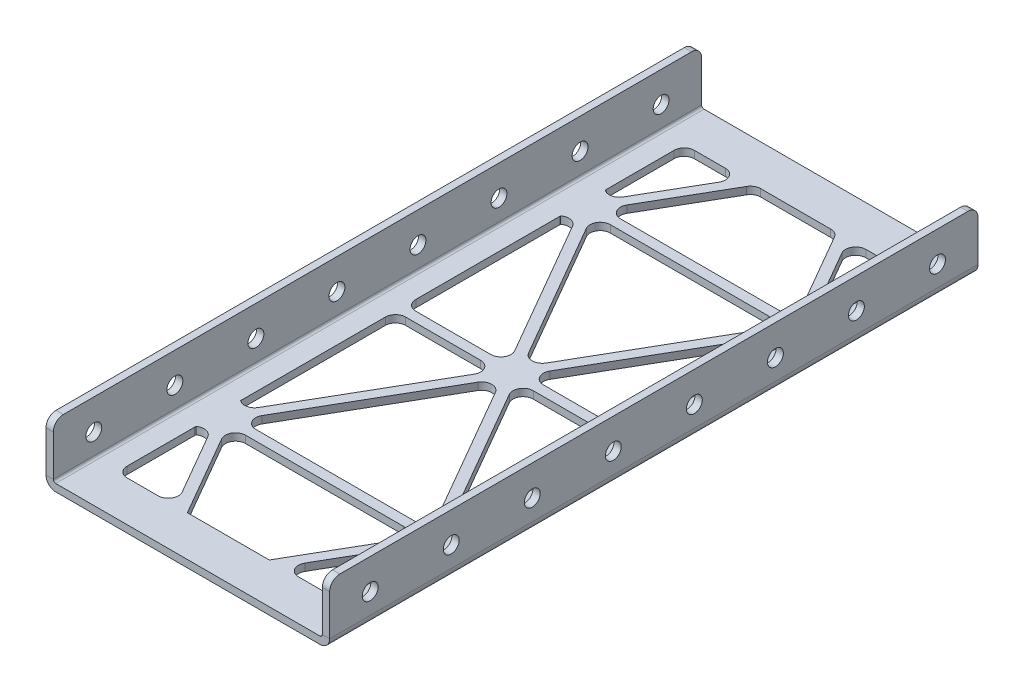
from build123d import *

# Parameters (mm, degrees)
BASE_FLANGE1_START             = -2.286
BASE_FLANGE1_OUTLINE_W         = 88.9
BASE_FLANGE1_OUTLINE_H         = 203.2
BASE_FLANGE1_DEPTH             = 2.286
EDGE_FLANGE1_STRIP_W           = 10.668
EDGE_FLANGE1_STRIP_H           = 2.286
EDGE_FLANGE1_STRIP_CUT_DEPTH   = 203.2
EDGE_FLANGE1_STRIP_2_W         = 10.668
EDGE_FLANGE1_STRIP_2_H         = 2.286
EDGE_FLANGE1_STRIP_CUT_2_DEPTH = 203.2
EDGE_FLANGE1_DEPTH             = 203.2
EDGE_FLANGE1_BEND_DEPTH        = 203.2
SKETCH22_R                     = 2.4892
CUT_EXTRUDE1_DEPTH             = 223.428599096
FILLET2_R                      = 3.175
CUT_EXTRUDE3_REACH             = 224.429
SKETCH25_W                     = 69.85
SKETCH25_H                     = 177.8
SKETCH2_W                      = 69.85
SKETCH2_H                      = 3.175
EXTRUDE_THIN1_DEPTH            = 2.286
SURFACECUT4_START              = -2.286
SURFACECUT4_DEPTH              = 2.286
FILLET4_R                      = 3.175


# Read off the part's stored shape, not the designer's step: Base-Flange1, SurfaceCut4
# Sheet-metal steps are written as plain solids
with BuildPart() as part:
    # Base-Flange1 outline → Base-Flange1 (new body)
    with BuildSketch(Plane(origin=(0, 0, 0), x_dir=(1, 0, 0), z_dir=(0, 1, 0)).offset(BASE_FLANGE1_START)):
        with Locations((44.45, 101.6)):
            Rectangle(BASE_FLANGE1_OUTLINE_W, BASE_FLANGE1_OUTLINE_H)
    extrude(amount=BASE_FLANGE1_DEPTH)

    # Edge-Flange1 strip (across the edge) → Edge-Flange1 strip cut (cut)
    with BuildSketch(Plane(origin=(88.9, 0, 0), x_dir=(-1, 0, 0), z_dir=(0, 0, -1))):
        with Locations((-2.286, -1.143)):
            Rectangle(EDGE_FLANGE1_STRIP_W, EDGE_FLANGE1_STRIP_H)
    extrude(amount=EDGE_FLANGE1_STRIP_CUT_DEPTH, mode=Mode.SUBTRACT)

    # Edge-Flange1 strip 2 (across the edge) → Edge-Flange1 strip cut 2 (cut)
    with BuildSketch(Plane.XY.offset(-203.2)):
        with Locations((-2.286, -1.143)):
            Rectangle(EDGE_FLANGE1_STRIP_2_W, EDGE_FLANGE1_STRIP_2_H)
    extrude(amount=EDGE_FLANGE1_STRIP_CUT_2_DEPTH, mode=Mode.SUBTRACT)

    # Edge-Flange1 section (across the edge) → Edge-Flange1 (add)
    with BuildSketch(Plane(origin=(88.9, 0, 0), x_dir=(-1, 0, 0), z_dir=(0, 0, -1))):
        with BuildLine():
            Line((0, 0.762), (0, 16.764))
            Line((0, 16.764), (2.286, 16.764))
            Line((2.286, 16.764), (2.286, 0.762))
            ThreePointArc((2.286, 0.762), (2.509184633, 0.223184633), (3.048, 0))
            Line((3.048, 0), (3.048, -2.286))
            ThreePointArc((3.048, -2.286), (0.892738531, -1.393261469), (0, 0.762))
        make_face()
    extrude(amount=EDGE_FLANGE1_DEPTH)

    # Edge-Flange1 section 2 (across the edge) → Edge-Flange1 bend (add)
    with BuildSketch(Plane.XY.offset(-203.2)):
        with BuildLine():
            Line((0, 0.762), (0, 16.764))
            Line((0, 16.764), (2.286, 16.764))
            Line((2.286, 16.764), (2.286, 0.762))
            ThreePointArc((2.286, 0.762), (2.509184633, 0.223184633), (3.048, 0))
            Line((3.048, 0), (3.048, -2.286))
            ThreePointArc((3.048, -2.286), (0.892738531, -1.393261469), (0, 0.762))
        make_face()
    extrude(amount=EDGE_FLANGE1_BEND_DEPTH)

    # Sketch22 → Cut-Extrude1 (cut, through all)
    with BuildSketch(Plane(origin=(88.9, 0, 0), x_dir=(0, 0, -1), z_dir=(1, 0, 0))):
        with Locations(Location((12.7, 7.239, 0), (0, 0, 90))):
            Circle(SKETCH22_R)
        with Locations(Location((38.1, 7.239, 0), (0, 0, 90))):
            Circle(SKETCH22_R)
        with Locations(Location((63.5, 7.239, 0), (0, 0, 90))):
            Circle(SKETCH22_R)
        with Locations(Location((88.9, 7.239, 0), (0, 0, 90))):
            Circle(SKETCH22_R)
        with Locations(Location((114.3, 7.239, 0), (0, 0, 90))):
            Circle(SKETCH22_R)
        with Locations(Location((139.7, 7.239, 0), (0, 0, 90))):
            Circle(SKETCH22_R)
        with Locations(Location((165.1, 7.239, 0), (0, 0, 90))):
            Circle(SKETCH22_R)
        with Locations(Location((190.5, 7.239, 0), (0, 0, 90))):
            Circle(SKETCH22_R)
        with Locations((215.9, 7.239)):
            Circle(SKETCH22_R)
        with Locations((241.3, 7.239)):
            Circle(SKETCH22_R)
        with Locations((266.7, 7.239)):
            Circle(SKETCH22_R)
        with Locations((292.1, 7.239)):
            Circle(SKETCH22_R)
        with Locations((317.5, 7.239)):
            Circle(SKETCH22_R)
        with Locations((342.9, 7.239)):
            Circle(SKETCH22_R)
        with Locations((368.3, 7.239)):
            Circle(SKETCH22_R)
        with Locations((393.7, 7.239)):
            Circle(SKETCH22_R)
    extrude(amount=-CUT_EXTRUDE1_DEPTH, mode=Mode.SUBTRACT)

    # Fillet2
    fillet2_edges = [part.edges().sort_by_distance(p)[0] for p in [
        (87.757, 16.764, 0),
        (87.757, 16.764, -203.2),
        (1.143, 16.764, -203.2),
        (1.143, 16.764, 0),
    ]]
    fillet(fillet2_edges, radius=FILLET2_R)

    # Sketch25 → Cut-Extrude3 (cut, up to next)
    with BuildSketch(Plane(origin=(0, 0, 0), x_dir=(1, 0, 0), z_dir=(0, 1, 0)), mode=Mode.PRIVATE) as cut_extrude3_sk1:
        with Locations((44.45, 101.6)):
            Rectangle(SKETCH25_W, SKETCH25_H)
    cut_extrude3_tool1 = extrude(cut_extrude3_sk1.sketch, amount=-CUT_EXTRUDE3_REACH, mode=Mode.PRIVATE) & part.part
    add(cut_extrude3_tool1.solids().sort_by_distance((44.45, 0, -101.6))[0], mode=Mode.SUBTRACT)

    # Sketch2 → Extrude-Thin1 (add)
    with BuildSketch(Plane(origin=(0, 0, 0), x_dir=(1, 0, 0), z_dir=(0, 1, 0))):
        with Locations((44.45, 101.6)):
            Rectangle(SKETCH2_W, SKETCH2_H)
        Polygon((4.149684671, 168.22719371), (82.000684671, 33.38530629), (84.750315329, 34.97280629), (6.899315329, 169.81469371), align=None)
        Polygon((6.899315329, 33.38530629), (84.750315329, 168.22719371), (82.000684671, 169.81469371), (4.149684671, 34.97280629), align=None)
        with Locations((44.45, 44.45)):
            Rectangle(SKETCH2_W, SKETCH2_H)
        with Locations((44.45, -12.7)):
            Rectangle(SKETCH2_W, SKETCH2_H)
        Polygon((4.149684671, 53.92719371), (82.000684671, -80.91469371), (84.750315329, -79.32719371), (6.899315329, 55.51469371), align=None)
        Polygon((6.899315329, -80.91469371), (84.750315329, 53.92719371), (82.000684671, 55.51469371), (4.149684671, -79.32719371), align=None)
        Polygon((4.149684671, 396.82719371), (82.000684671, 261.98530629), (84.750315329, 263.57280629), (6.899315329, 398.41469371), align=None)
        Polygon((6.899315329, 261.98530629), (84.750315329, 396.82719371), (82.000684671, 398.41469371), (4.149684671, 263.57280629), align=None)
        with Locations((44.45, 330.2)):
            Rectangle(SKETCH2_W, SKETCH2_H)
        with Locations((44.45, 273.05)):
            Rectangle(SKETCH2_W, SKETCH2_H)
        with Locations((44.45, -127)):
            Rectangle(SKETCH2_W, SKETCH2_H)
        Polygon((4.149684671, -60.37280629), (82.000684671, -195.21469371), (84.750315329, -193.62719371), (6.899315329, -58.78530629), align=None)
        Polygon((6.899315329, -195.21469371), (84.750315329, -60.37280629), (82.000684671, -58.78530629), (4.149684671, -193.62719371), align=None)
        with Locations((44.45, -184.15)):
            Rectangle(SKETCH2_W, SKETCH2_H)
        with Locations((44.45, -69.85)):
            Rectangle(SKETCH2_W, SKETCH2_H)
        Polygon((4.149684671, 282.52719371), (82.000684671, 147.68530629), (84.750315329, 149.27280629), (6.899315329, 284.11469371), align=None)
        Polygon((6.899315329, 147.68530629), (84.750315329, 282.52719371), (82.000684671, 284.11469371), (4.149684671, 149.27280629), align=None)
        with Locations((44.45, 215.9)):
            Rectangle(SKETCH2_W, SKETCH2_H)
        with Locations((44.45, 158.75)):
            Rectangle(SKETCH2_W, SKETCH2_H)
    extrude(amount=-EXTRUDE_THIN1_DEPTH)

    # SurfaceCut4 outline → SurfaceCut4 (cut)
    # profile 1 of 2: a face of its own
    with BuildSketch(Plane(origin=(0, 0, 0), x_dir=(1, 0, 0), z_dir=(0, 1, 0)).offset(SURFACECUT4_START)):
        Polygon((41.700369343, -14.2875), (11.454432116, -66.675), (6.899315329, -58.78530629), (4.149684671, -60.37280629), (9.525, -69.683125546), (9.525, -70.016874454), (4.149684671, -79.32719371), (6.899315329, -80.91469371), (11.454432116, -73.025), (41.700369343, -125.4125), (9.525, -125.4125), (9.525, -128.5875), (41.700369343, -128.5875), (10.537888563, -182.5625), (9.525, -182.5625), (9.525, -184.316874454), (4.149684671, -193.62719371), (6.899315329, -195.21469371), (12.370975668, -185.7375), (76.529024332, -185.7375), (82.000684671, -195.21469371), (84.750315329, -193.62719371), (79.375, -184.316874454), (79.375, -182.5625), (78.362111437, -182.5625), (47.199630657, -128.5875), (79.375, -128.5875), (79.375, -125.4125), (47.199630657, -125.4125), (77.445567884, -73.025), (82.000684671, -80.91469371), (84.750315329, -79.32719371), (79.375, -70.016874454), (79.375, -69.683125546), (84.750315329, -60.37280629), (82.000684671, -58.78530629), (77.445567884, -66.675), (47.199630657, -14.2875), (79.375, -14.2875), (79.375, -11.1125), (47.199630657, -11.1125), (53.615435523, 0), (49.949261314, 0), (44.45, -9.525), (38.950738686, 0), (35.284564477, 0), (41.700369343, -11.1125), (9.525, -11.1125), (9.525, -14.2875), align=None)
        Polygon((74.695937227, -182.5625), (14.204062773, -182.5625), (44.45, -130.175), align=None, mode=Mode.SUBTRACT)
        Polygon((44.45, -123.825), (14.204062773, -71.4375), (74.695937227, -71.4375), align=None, mode=Mode.SUBTRACT)
        Polygon((74.695937227, -68.2625), (14.204062773, -68.2625), (44.45, -15.875), align=None, mode=Mode.SUBTRACT)
    # profile 2 of 2: a face of its own
    with BuildSketch(Plane(origin=(0, 0, 0), x_dir=(1, 0, 0), z_dir=(0, 1, 0)).offset(SURFACECUT4_START)):
        Polygon((82.000684671, 284.11469371), (77.445567884, 276.225), (47.199630657, 328.6125), (79.375, 328.6125), (79.375, 331.7875), (47.199630657, 331.7875), (84.750315329, 396.82719371), (82.000684671, 398.41469371), (44.45, 333.375), (6.899315329, 398.41469371), (4.149684671, 396.82719371), (41.700369343, 331.7875), (9.525, 331.7875), (9.525, 328.6125), (41.700369343, 328.6125), (11.454432116, 276.225), (6.899315329, 284.11469371), (4.149684671, 282.52719371), (9.525, 273.216874454), (9.525, 272.883125546), (4.149684671, 263.57280629), (6.899315329, 261.98530629), (11.454432116, 269.875), (41.700369343, 217.4875), (9.525, 217.4875), (9.525, 214.3125), (41.700369343, 214.3125), (35.284564477, 203.2), (38.950738686, 203.2), (44.45, 212.725), (49.949261314, 203.2), (53.615435523, 203.2), (47.199630657, 214.3125), (79.375, 214.3125), (79.375, 217.4875), (47.199630657, 217.4875), (77.445567884, 269.875), (82.000684671, 261.98530629), (84.750315329, 263.57280629), (79.375, 272.883125546), (79.375, 273.216874454), (84.750315329, 282.52719371), align=None)
        Polygon((74.695937227, 271.4625), (44.45, 219.075), (14.204062773, 271.4625), align=None, mode=Mode.SUBTRACT)
        Polygon((74.695937227, 274.6375), (14.204062773, 274.6375), (44.45, 327.025), align=None, mode=Mode.SUBTRACT)
    extrude(amount=SURFACECUT4_DEPTH, mode=Mode.SUBTRACT)

    # Fillet4
    # the kernel refuses this fillet: 3.175 mm, written as the material it adds along each edge
    with BuildSketch(Plane(origin=(79.375, 0, -152.233125546), x_dir=(-0.5000000000000283, 0, -0.8660254037844223), z_dir=(0, -1, 0)), Plane(origin=(79.375, -2.286, -165.266874454), x_dir=(-0.5000000000000032, 0, 0.8660254037844368), z_dir=(0, 1, 0)), Plane(origin=(9.525, -2.286, -37.933125546), x_dir=(0.4999999999999835, 0, -0.8660254037844481), z_dir=(0, 1, 0)), Plane(origin=(9.525, -2.286, -152.233125546), x_dir=(0.4999999999999966, 0, -0.8660254037844406), z_dir=(0, 1, 0)), Plane(origin=(79.375, -2.286, -50.966874454), x_dir=(-0.4999999999999871, 0, 0.8660254037844461), z_dir=(0, 1, 0))) as fillet4_piece_1:
        with BuildLine():
            CenterArc((FILLET4_R * 0.267949192431, -FILLET4_R), FILLET4_R, 90, 30)
            Line((-FILLET4_R * 0.232050807569, -FILLET4_R * 0.133974596216), (0, 0))
            Line((0, 0), (FILLET4_R * 0.267949192431, 0))
        make_face()
    extrude(amount=2.286)
    with BuildSketch(Plane(origin=(79.375, 0, -103.1875), x_dir=(-1, 0, 0), z_dir=(0, -1, 0)), Plane(origin=(9.525, 0, -12.7), x_dir=(0, 0, -1), z_dir=(0, -1, 0)), Plane(origin=(9.525, 0, -190.5), x_dir=(1, 0, 0), z_dir=(0, -1, 0)), Plane(origin=(9.525, 0, -100.0125), x_dir=(1, 0, 0), z_dir=(0, -1, 0)), Plane(origin=(9.525, 0, -103.1875), x_dir=(0, 0, -1), z_dir=(0, -1, 0))) as fillet4_piece_2:
        with BuildLine():
            CenterArc((FILLET4_R, FILLET4_R), FILLET4_R, 180, 90)
            Line((0, FILLET4_R), (0, 0))
            Line((0, 0), (FILLET4_R, 0))
        make_face()
    extrude(amount=2.286)
    with BuildSketch(Plane(origin=(14.204062773, -2.286, -46.0375), x_dir=(1, 0, 0), z_dir=(0, 1, 0)), Plane(origin=(47.199630657, 0, -103.1875), x_dir=(0.49999999999999895, 0, -0.8660254037844393), z_dir=(0, -1, 0)), Plane(origin=(14.204062773, -2.286, -160.3375), x_dir=(1, 0, 0), z_dir=(0, 1, 0)), Plane(origin=(27.952216058, 0, -12.7), x_dir=(-1, 0, 0), z_dir=(0, -1, 0)), Plane(origin=(41.700369343, 0, -100.0125), x_dir=(-0.4999999999999996, 0, 0.8660254037844388), z_dir=(0, -1, 0)), Plane(origin=(74.695937227, 0, -160.3375), x_dir=(-1, 0, 0), z_dir=(0, -1, 0)), Plane(origin=(74.695937227, 0, -46.0375), x_dir=(-1, 0, 0), z_dir=(0, -1, 0)), Plane(origin=(41.700369343, -2.286, -103.1875), x_dir=(-0.4999999999999983, 0, -0.8660254037844397), z_dir=(0, 1, 0)), Plane(origin=(77.445567884, 0, -155.575), x_dir=(0.4999999999999918, 0, 0.8660254037844435), z_dir=(0, -1, 0)), Plane(origin=(60.947783942, 0, -190.5), x_dir=(1, 0, 0), z_dir=(0, -1, 0)), Plane(origin=(11.454432116, -2.286, -161.925), x_dir=(0.5000000000000006, 0, -0.8660254037844383), z_dir=(0, 1, 0)), Plane(origin=(77.445567884, 0, -161.925), x_dir=(-0.4999999999999959, 0, -0.866025403784441), z_dir=(0, -1, 0))) as fillet4_piece_3:
        with BuildLine():
            CenterArc((FILLET4_R * 1.73205080757, FILLET4_R), FILLET4_R, 150, 120)
            Line((FILLET4_R * 0.866025403784, FILLET4_R * 1.5), (0, 0))
            Line((0, 0), (FILLET4_R * 1.73205080757, 0))
        make_face()
    extrude(amount=2.286)
    with BuildSketch(Plane(origin=(31.618390267, 0, -190.5), x_dir=(1, 0, 0), z_dir=(0, -1, 0))) as fillet4_piece_4:
        with BuildLine():
            CenterArc((FILLET4_R * 0.57735026919, FILLET4_R), FILLET4_R, 210, 60)
            Line((-FILLET4_R * 0.288675134595, FILLET4_R * 0.5), (0, 0))
            Line((0, 0), (FILLET4_R * 0.57735026919, 0))
        make_face()
    extrude(amount=2.286)
    with BuildSketch(Plane(origin=(27.952216058, -2.286, -190.5), x_dir=(-0.4999999999999949, 0, 0.8660254037844416), z_dir=(0, 1, 0)), Plane(origin=(74.695937227, -2.286, -157.1625), x_dir=(-0.5000000000000017, 0, 0.8660254037844376), z_dir=(0, 1, 0)), Plane(origin=(60.947783942, -2.286, -12.7), x_dir=(0.49999999999999606, 0, -0.8660254037844409), z_dir=(0, 1, 0)), Plane(origin=(74.695937227, 0, -42.8625), x_dir=(-1, 0, 0), z_dir=(0, -1, 0)), Plane(origin=(77.445567884, -2.286, -47.625), x_dir=(-0.4999999999999986, 0, -0.8660254037844394), z_dir=(0, 1, 0)), Plane(origin=(44.45, -2.286, -98.425), x_dir=(0.4999999999999966, 0, 0.8660254037844407), z_dir=(0, 1, 0)), Plane(origin=(11.454432116, 0, -47.625), x_dir=(0.49999999999999967, 0, -0.8660254037844389), z_dir=(0, -1, 0)), Plane(origin=(11.454432116, -2.286, -155.575), x_dir=(0.4999999999999995, 0, 0.8660254037844389), z_dir=(0, 1, 0)), Plane(origin=(44.45, -2.286, -104.775), x_dir=(-0.4999999999999956, 0, -0.8660254037844413), z_dir=(0, 1, 0)), Plane(origin=(11.454432116, 0, -41.275), x_dir=(-0.49999999999999845, 0, 0.8660254037844395), z_dir=(0, -1, 0)), Plane(origin=(77.445567884, -2.286, -41.275), x_dir=(0.49999999999999645, 0, 0.8660254037844408), z_dir=(0, 1, 0)), Plane(origin=(14.204062773, 0, -157.1625), x_dir=(0.49999999999999767, 0, 0.86602540378444), z_dir=(0, -1, 0)), Plane(origin=(14.204062773, -2.286, -42.8625), x_dir=(1, 0, 0), z_dir=(0, 1, 0)), Plane(origin=(47.199630657, -2.286, -100.0125), x_dir=(1, 0, 0), z_dir=(0, 1, 0))) as fillet4_piece_5:
        with BuildLine():
            CenterArc((FILLET4_R * 1.73205080757, -FILLET4_R), FILLET4_R, 90, 120)
            Line((FILLET4_R * 0.866025403784, -FILLET4_R * 1.5), (0, 0))
            Line((0, 0), (FILLET4_R * 1.73205080757, 0))
        make_face()
    extrude(amount=2.286)
    with BuildSketch(Plane(origin=(9.525, 0, -165.266874454), x_dir=(0, 0, -1), z_dir=(0, -1, 0)), Plane(origin=(9.525, 0, -50.966874454), x_dir=(0, 0, -1), z_dir=(0, -1, 0)), Plane(origin=(79.375, 0, -37.933125546), x_dir=(0, 0, 1), z_dir=(0, -1, 0))) as fillet4_piece_6:
        with BuildLine():
            CenterArc((FILLET4_R * 0.267949192431, FILLET4_R), FILLET4_R, 240, 30)
            Line((-FILLET4_R * 0.232050807569, FILLET4_R * 0.133974596216), (0, 0))
            Line((0, 0), (FILLET4_R * 0.267949192431, 0))
        make_face()
    extrude(amount=2.286)
    with BuildSketch(Plane(origin=(79.375, 0, -12.7), x_dir=(0, 0, -1), z_dir=(0, -1, 0)), Plane(origin=(79.375, 0, -190.5), x_dir=(-1, 0, 0), z_dir=(0, -1, 0)), Plane(origin=(79.375, 0, -100.0125), x_dir=(-1, 0, 0), z_dir=(0, -1, 0))) as fillet4_piece_7:
        with BuildLine():
            CenterArc((FILLET4_R, -FILLET4_R), FILLET4_R, 90, 90)
            Line((0, -FILLET4_R), (0, 0))
            Line((0, 0), (FILLET4_R, 0))
        make_face()
    extrude(amount=2.286)
    with BuildSketch(Plane(origin=(57.281609733, -2.286, -190.5), x_dir=(0.4999999999999892, 0, 0.8660254037844448), z_dir=(0, 1, 0))) as fillet4_piece_8:
        with BuildLine():
            CenterArc((FILLET4_R * 0.57735026919, -FILLET4_R), FILLET4_R, 90, 60)
            Line((-FILLET4_R * 0.288675134595, -FILLET4_R * 0.5), (0, 0))
            Line((0, 0), (FILLET4_R * 0.57735026919, 0))
        make_face()
    extrude(amount=2.286)


solid = part.part
